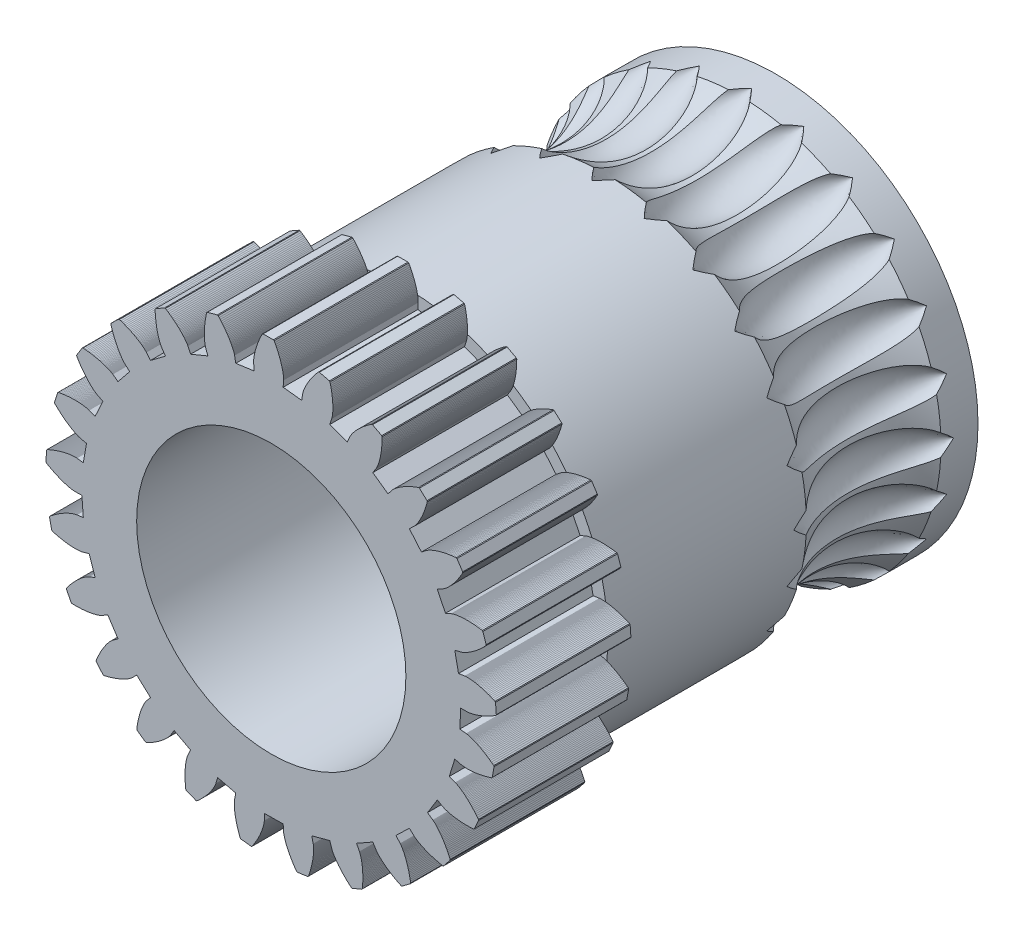
from build123d import *

# Parameters (mm, degrees)
CROQUIS9_R            = 8.142396537
CORTAR_EXTRUIR1_DEPTH = 4
MATRIZC1_COUNT        = 24


with BuildPart() as part:
    # Croquis1 → Revolución1 (revolve)
    with BuildSketch(Plane(origin=(0, 0, 0), x_dir=(1, 0, 0), z_dir=(0, 1, 0))):
        with BuildLine():
            Line((4, 0), (4, 15))
            Line((4, 15), (6, 15))
            Line((6, 15), (6, 13.9))
            ThreePointArc((6, 13.9), (5.275, 11.9), (6, 9.9))
            Line((6, 9.9), (6, 4))
            Line((6, 4), (6.75, 4))
            Line((6.75, 4), (6.75, 0))
            Line((6.75, 0), (4, 0))
        make_face()
    revolve(axis=Axis((0, 0, 0), (0, 0, -1)))

    # Croquis9 → Cortar-Extruir1 (cut)
    with BuildSketch(Plane.XY):
        Circle(CROQUIS9_R)
        Polygon((5.6296, 0), (5.8269832, 1.24e-05), (5.8289672, 6.2e-05), (5.832092, 0.0001798), (5.8363452, 0.000403), (5.8417268, 0.0007626), (5.8482368, 0.0012896), (5.855869, 0.002015), (5.8646172, 0.0029636), (5.8744814, 0.0041788), (5.8854554, 0.0056792), (5.8975268, 0.0075082), (5.9106956, 0.0096906), (5.9249494, 0.0122574), (5.9402758, 0.0152334), (5.9566748, 0.018662), (5.974134, 0.022568), (5.992641, 0.0269762), (6.0121834, 0.0319238), (6.032755, 0.0374356), (6.0543434, 0.0435488), (6.0769238, 0.050282), (6.1005024, 0.0576724), (6.1250482, 0.0657448), (6.1505488, 0.074524), (6.176998, 0.0840472), (6.2043772, 0.0943392), (6.2326678, 0.105431), (6.261845, 0.1173412), (6.2919088, 0.1301008), (6.322822, 0.1437346), (6.3545784, 0.1582798), (6.3871532, 0.1737488), (6.4205278, 0.1901726), (6.4546836, 0.207576), (6.4895958, 0.2259838), (6.5252458, 0.2454208), (6.561615, 0.265918), (6.5986724, 0.2874816), (6.6363932, 0.310155), (6.674765, 0.3339444), (6.686452, 0.3574238), (6.6628982, 0.6649624), (6.6477764, 0.6863896), (6.6062302, 0.7040596), (6.56549, 0.720719), (6.5255806, 0.7363926), (6.4865206, 0.7511114), (6.4483224, 0.764894), (6.411017, 0.7777714), (6.3746106, 0.7897684), (6.3391218, 0.8009222), (6.3045692, 0.8112514), (6.2709714, 0.820787), (6.2383346, 0.8295538), (6.2066836, 0.837589), (6.1760308, 0.8449174), (6.1463824, 0.85157), (6.117757, 0.8575716), (6.090167, 0.8629532), (6.0636248, 0.867752), (6.0381304, 0.8719928), (6.0137086, 0.8757066), (5.9903594, 0.8789244), (5.9681014, 0.881671), (5.9469284, 0.8839898), (5.926859, 0.8858994), (5.9078932, 0.8874432), (5.8900496, 0.8886398), (5.8733158, 0.8895326), (5.8577104, 0.8901464), (5.8432334, 0.8905122), (5.829891, 0.890661), (5.817677, 0.89063), (5.80661, 0.890444), (5.7966714, 0.8901402), (5.7878798, 0.8897496), (5.780229, 0.8893032), (5.7737128, 0.8888258), (5.7683374, 0.8883608), (5.7640966, 0.8879392), (5.7609966, 0.8875796), (5.759025, 0.8873254), (5.563942, 0.8572802), (5.4527388, 1.400022), (5.6439158, 1.4491198), (5.6458254, 1.4496654), (5.64882, 1.4505582), (5.652881, 1.4518354), (5.6580084, 1.4535218), (5.6641836, 1.4556484), (5.6713942, 1.4582462), (5.679634, 1.46134), (5.6888844, 1.4649732), (5.6991392, 1.4691582), (5.7103798, 1.473926), (5.7225876, 1.4793138), (5.7357564, 1.4853464), (5.7498614, 1.4920424), (5.7648964, 1.4994452), (5.7808366, 1.5075672), (5.7976634, 1.5164394), (5.8153644, 1.5260928), (5.8339148, 1.536546), (5.8533022, 1.54783), (5.8735018, 1.5599696), (5.8945012, 1.5729896), (5.9162694, 1.5869148), (5.9387878, 1.6017638), (5.9620378, 1.6175676), (5.9859946, 1.6343448), (6.0106334, 1.652114), (6.0359418, 1.6709124), (6.0618826, 1.6907462), (6.088431, 1.7116402), (6.1155746, 1.7336254), (6.1432824, 1.756708), (6.1715234, 1.780919), (6.200279, 1.8062708), (6.2295182, 1.832782), (6.25921, 1.8604774), (6.2893358, 1.8893694), (6.3198646, 1.9194766), (6.3507716, 1.9508114), (6.3820196, 1.9834048), (6.3875004, 2.009048), (6.2882012, 2.301068), (6.2682248, 2.318056), (6.223591, 2.324845), (6.1799864, 2.3308466), (6.1374358, 2.3361042), (6.0959392, 2.3406426), (6.0555152, 2.3444928), (6.0161762, 2.347692), (5.9779284, 2.3502588), (5.9407842, 2.3522366), (5.9047498, 2.353644), (5.8698314, 2.3545244), (5.8360476, 2.3549026), (5.8033922, 2.3548158), (5.7718776, 2.3542888), (5.74151, 2.3533588), (5.7122894, 2.3520506), (5.6842282, 2.3504076), (5.6573202, 2.3484546), (5.6315778, 2.3462164), (5.607001, 2.3437426), (5.5835836, 2.3410518), (5.561338, 2.3381812), (5.540258, 2.3351556), (5.5203436, 2.3320184), (5.5015886, 2.3287944), (5.4840054, 2.3255208), (5.4675816, 2.3222224), (5.452311, 2.3189302), (5.4381998, 2.3156876), (5.4252356, 2.3125132), (5.4134184, 2.3094442), (5.4027358, 2.3065116), (5.393194, 2.3037464), (5.3847744, 2.3011796), (5.3774708, 2.2988422), (5.371277, 2.2967652), (5.3661868, 2.2949796), (5.3621878, 2.2935164), (5.3592738, 2.2924004), (5.3574262, 2.2916626), (5.175946, 2.2140448), (4.9332532, 2.7120784), (5.1062208, 2.8071802), (5.1079382, 2.8081784), (5.1106104, 2.8097904), (5.1142312, 2.8120348), (5.1187758, 2.8149426), (5.1242256, 2.8185386), (5.1305682, 2.8228476), (5.1377788, 2.8279006), (5.1458388, 2.8337162), (5.1547296, 2.8403192), (5.1644264, 2.8477344), (5.1749106, 2.8559866), (5.1861698, 2.8651068), (5.1981668, 2.8751012), (5.210883, 2.886007), (5.2242998, 2.8978366), (5.2383924, 2.9106148), (5.253136, 2.9243664), (5.2685058, 2.93911), (5.2844832, 2.9548642), (5.3010248, 2.9716414), (5.3181244, 2.9894726), (5.3357448, 3.0083764), (5.3538674, 3.028359), (5.372455, 3.0494452), (5.391489, 3.0716536), (5.4109384, 3.0949966), (5.4307722, 3.1194928), (5.4509656, 3.1451546), (5.4714876, 3.1720006), (5.4923072, 3.2000432), (5.5133996, 3.2292886), (5.53474, 3.2597616), (5.556285, 3.2914684), (5.5780098, 3.3244214), (5.5998834, 3.3586268), (5.621881, 3.3941032), (5.6439592, 3.4308568), (5.6660994, 3.4689), (5.6882644, 3.5082328), (5.6871918, 3.5344402), (5.5183968, 3.7925896), (5.4948182, 3.8040782), (5.4498992, 3.799546), (5.4061706, 3.7945178), (5.363651, 3.7890308), (5.322328, 3.7831098), (5.2822202, 3.7767858), (5.2433214, 3.770096), (5.2056378, 3.7630714), (5.1691694, 3.7557492), (5.13391, 3.7481542), (5.0998782, 3.7403236), (5.0670554, 3.7322884), (5.0354478, 3.7240796), (5.0050554, 3.7157344), (4.975872, 3.7072776), (4.9478976, 3.6987464), (4.921126, 3.6901718), (4.895551, 3.681591), (4.8711726, 3.6730226), (4.8479784, 3.66451), (4.8259684, 3.6560842), (4.8051364, 3.64777), (4.78547, 3.6395984), (4.7669568, 3.6316066), (4.749603, 3.6238194), (4.7333838, 3.616274), (4.718293, 3.6089952), (4.7043244, 3.602014), (4.6914594, 3.5953614), (4.6796918, 3.5890622), (4.6690092, 3.5831536), (4.659393, 3.5776542), (4.650837, 3.5726012), (4.6433164, 3.5680256), (4.636825, 3.563946), (4.6313442, 3.5603934), (4.6268616, 3.5573988), (4.6233524, 3.5549808), (4.6208042, 3.5531766), (4.6191984, 3.5520048), (4.4627228, 3.4316938), (4.1038048, 3.8537278), (4.247682, 3.9888506), (4.2490956, 3.9902456), (4.2512842, 3.9924714), (4.2542354, 3.9955466), (4.257912, 3.999496), (4.2622954, 4.004332), (4.267367, 4.0100856), (4.2730958, 4.0167692), (4.279457, 4.0244076), (4.2864258, 4.0330132), (4.2939712, 4.0426108), (4.3020808, 4.0532128), (4.3107112, 4.0648378), (4.3198438, 4.0775044), (4.3294538, 4.0912312), (4.3395102, 4.1060244), (4.349982, 4.1219088), (4.3608382, 4.1388968), (4.3720602, 4.1569946), (4.383617, 4.176227), (4.3954714, 4.196594), (4.4075924, 4.2181204), (4.4199614, 4.2408062), (4.4325412, 4.26467), (4.445307, 4.289718), (4.4582154, 4.3159626), (4.4712478, 4.34341), (4.484367, 4.3720664), (4.497542, 4.4019442), (4.5107418, 4.4330496), (4.5239416, 4.4653888), (4.537098, 4.4989618), (4.5501862, 4.533781), (4.563169, 4.5698526), (4.5760154, 4.6071704), (4.5887006, 4.6457468), (4.6011812, 4.6855756), (4.6134262, 4.7266692), (4.6254108, 4.7690152), (4.6370916, 4.812626), (4.62954, 4.8377422), (4.401845, 5.045808), (4.3761522, 5.0510718), (4.333769, 5.0355098), (4.2926692, 5.019768), (4.2528466, 5.0038774), (4.2143012, 4.9878628), (4.1770206, 4.9717676), (4.1410048, 4.9556104), (4.1062538, 4.9394408), (4.072749, 4.9232712), (4.0404966, 4.9071512), (4.0094718, 4.8910994), (3.9796808, 4.875153), (3.9511112, 4.859343), (3.9237444, 4.8437004), (3.8975804, 4.8282562), (3.8726068, 4.8130352), (3.8488112, 4.7980746), (3.826175, 4.7833992), (3.804692, 4.76904), (3.7843436, 4.755028), (3.7651236, 4.741388), (3.7470134, 4.7281572), (3.7299944, 4.7153542), (3.7140542, 4.70301), (3.6991742, 4.6911494), (3.685342, 4.6798096), (3.672539, 4.669003), (3.6607404, 4.6587668), (3.64994, 4.6491258), (3.6401068, 4.6400986), (3.6312284, 4.6317162), (3.6232862, 4.6240034), (3.6162492, 4.6169788), (3.6101112, 4.6106734), (3.604835, 4.605112), (3.6004082, 4.600307), (3.5968122, 4.5962894), (3.594016, 4.5930778), (3.5919948, 4.5906908), (3.59073, 4.5891594), (3.4690922, 4.433713), (3.0164922, 4.75323), (3.1222456, 4.919886), (3.1232686, 4.921591), (3.1248372, 4.9242942), (3.1269266, 4.9280018), (3.1295058, 4.9327448), (3.13255, 4.9385232), (3.1360344, 4.9453494), (3.1399156, 4.9532482), (3.1441812, 4.962232), (3.1487878, 4.9723008), (3.1537168, 4.9834732), (3.1589248, 4.9957554), (3.1643994, 5.009166), (3.1700972, 5.023705), (3.1759872, 5.039391), (3.1820446, 5.0562178), (3.1882384, 5.0742102), (3.1945376, 5.093362), (3.200905, 5.1136856), (3.2073096, 5.135181), (3.2137266, 5.1578606), (3.2201188, 5.1817244), (3.2264552, 5.2067724), (3.2327048, 5.233017), (3.2388366, 5.260452), (3.2448196, 5.2890774), (3.2506104, 5.3189056), (3.2561904, 5.3499242), (3.2615224, 5.3821394), (3.2665754, 5.4155512), (3.2713184, 5.4501596), (3.275708, 5.4859522), (3.2797256, 5.522929), (3.283334, 5.5610962), (3.286496, 5.6004352), (3.2891868, 5.6409522), (3.2913692, 5.6826348), (3.2930122, 5.725483), (3.2940848, 5.7694844), (3.294556, 5.8146266), (3.2809966, 5.8370768), (3.0087112, 5.981977), (2.9825162, 5.9806874), (2.9453348, 5.9550752), (2.909443, 5.9296056), (2.8748222, 5.9043096), (2.8414662, 5.879212), (2.8093626, 5.85435), (2.778499, 5.8297484), (2.7488568, 5.8054382), (2.7204298, 5.7814504), (2.6931932, 5.757816), (2.6671408, 5.7345536), (2.642254, 5.7117004), (2.618508, 5.6892812), (2.5958966, 5.667327), (2.574395, 5.6458564), (2.5539908, 5.6249066), (2.5346592, 5.6044962), (2.5163816, 5.58465), (2.4991456, 5.565399), (2.4829264, 5.546768), (2.4676992, 5.5287818), (2.4534454, 5.511459), (2.4401464, 5.4948244), (2.4277774, 5.4789028), (2.4163136, 5.463719), (2.4057426, 5.4492916), (2.3960272, 5.4356392), (2.3871426, 5.4227928), (2.3790826, 5.4107648), (2.3718038, 5.39958), (2.3652876, 5.3892508), (2.3595092, 5.379802), (2.3544438, 5.3712522), (2.3500604, 5.36362), (2.3463404, 5.3569178), (2.3432466, 5.3511642), (2.3407604, 5.3463778), (2.3388508, 5.342571), (2.3374868, 5.3397624), (2.3366436, 5.3379582), (2.257482, 5.1571476), (1.7396394, 5.3540658), (1.8006288, 5.5417894), (1.801193, 5.543699), (1.8020424, 5.546706), (1.803146, 5.5508166), (1.8044666, 5.5560494), (1.8059794, 5.5624044), (1.8076472, 5.5698816), (1.8094452, 5.5784996), (1.8113424, 5.5882584), (1.8133016, 5.599158), (1.815298, 5.6112046), (1.8172882, 5.6243982), (1.8192536, 5.638745), (1.821157, 5.654245), (1.8229612, 5.6709044), (1.8246476, 5.6887108), (1.8261728, 5.7076766), (1.8275058, 5.7277956), (1.8286218, 5.7490616), (1.8294774, 5.7714746), (1.830054, 5.7950408), (1.8303082, 5.8197416), (1.8302214, 5.8455832), (1.829744, 5.8725532), (1.8288636, 5.9006516), (1.8275368, 5.929866), (1.8257326, 5.9601964), (1.82342, 5.9916304), (1.8205742, 6.0241618), (1.817158, 6.0577782), (1.8131404, 6.0924734), (1.8084966, 6.128235), (1.8031894, 6.1650506), (1.797194, 6.202914), (1.7904732, 6.2418066), (1.7830022, 6.2817222), (1.77475, 6.322636), (1.7656856, 6.364548), (1.7557842, 6.4074334), (1.7450148, 6.4512736), (1.726297, 6.4696442), (1.4265332, 6.5422772), (1.401479, 6.5345148), (1.3718368, 6.5004644), (1.3434036, 6.4668666), (1.3161608, 6.4337524), (1.290096, 6.4011528), (1.2651844, 6.3690864), (1.2414074, 6.3375842), (1.2187464, 6.3066648), (1.1971766, 6.2763592), (1.1766732, 6.2466922), (1.1572238, 6.2176824), (1.1387974, 6.1893546), (1.1213754, 6.1617398), (1.104933, 6.1348504), (1.0894454, 6.108705), (1.074894, 6.0833408), (1.0612478, 6.058764), (1.048482, 6.0349994), (1.0365718, 6.0120656), (1.0254924, 5.9899874), (1.015219, 5.9687772), (1.0057206, 5.9484536), (0.9969786, 5.9290352), (0.9889558, 5.9105344), (0.9816336, 5.892976), (0.9749748, 5.8763724), (0.9689608, 5.860736), (0.9635544, 5.8460854), (0.958737, 5.8324268), (0.9544652, 5.819785), (0.9507266, 5.80816), (0.9474778, 5.7975766), (0.9447002, 5.7880348), (0.9423504, 5.779547), (0.940416, 5.7721318), (0.9388474, 5.7657892), (0.9376322, 5.7605316), (0.936727, 5.7563714), (0.936107, 5.7533086), (0.935735, 5.7513556), (0.9040282, 5.5565392), (0.3534868, 5.6184896), (0.3658682, 5.8154822), (0.3659426, 5.8174724), (0.366017, 5.820591), (0.3660604, 5.8248504), (0.3660418, 5.8302444), (0.365924, 5.8367792), (0.3656822, 5.8444424), (0.3652854, 5.853234), (0.3646902, 5.863154), (0.363878, 5.8741962), (0.3628178, 5.8863606), (0.3614662, 5.899641), (0.3597984, 5.914025), (0.3577896, 5.9295126), (0.3553964, 5.9460914), (0.352594, 5.9637614), (0.3493576, 5.9825102), (0.3456438, 6.0023254), (0.341434, 6.0232008), (0.3366972, 6.0451302), (0.33139, 6.068095), (0.3255, 6.0920828), (0.3189838, 6.1170874), (0.3118166, 6.1430964), (0.3039736, 6.1700912), (0.2954238, 6.1980594), (0.28613, 6.2269886), (0.2760798, 6.2568602), (0.2652298, 6.2876618), (0.2535614, 6.3193686), (0.2410436, 6.3519744), (0.2276516, 6.3854606), (0.2133544, 6.4198024), (0.1981272, 6.4549812), (0.1819452, 6.4909846), (0.1647836, 6.5277816), (0.1466176, 6.5653598), (0.1274162, 6.6037006), (0.1071608, 6.642773), (0.0858266, 6.6825646), (0.0631284, 6.6957024), (-0.2452844, 6.691505), (-0.2676168, 6.6777534), (-0.2878598, 6.6373976), (-0.3070488, 6.5977858), (-0.3251962, 6.5589428), (-0.342333, 6.520881), (-0.3584902, 6.4836314), (-0.3736864, 6.4472002), (-0.3879464, 6.4116184), (-0.4013074, 6.3769046), (-0.4137818, 6.343065), (-0.4254068, 6.3101306), (-0.4362072, 6.2781138), (-0.446214, 6.2470332), (-0.455452, 6.216895), (-0.4639522, 6.187724), (-0.4717394, 6.1595326), (-0.4788446, 6.1323332), (-0.485305, 6.1061444), (-0.491133, 6.0809724), (-0.496372, 6.0568296), (-0.5010468, 6.0337284), (-0.5051946, 6.0116812), (-0.508834, 5.9907004), (-0.5120022, 5.9707922), (-0.5147302, 5.9519628), (-0.517049, 5.9342246), (-0.5189896, 5.9175838), (-0.5205768, 5.9020466), (-0.521854, 5.8876192), (-0.5228398, 5.874314), (-0.5235776, 5.8621248), (-0.524086, 5.8510578), (-0.5244084, 5.8411254), (-0.5245696, 5.8323276), (-0.5246006, 5.8246582), (-0.5245386, 5.8181296), (-0.5244146, 5.8127356), (-0.5242534, 5.8084762), (-0.5240922, 5.8053576), (-0.523962, 5.8033736), (-0.5062238, 5.6067964), (-1.0548804, 5.5298854), (-1.0918758, 5.7237656), (-1.0922974, 5.7257124), (-1.0930042, 5.7287504), (-1.094021, 5.732892), (-1.0953788, 5.7381124), (-1.0971148, 5.7444054), (-1.09926, 5.751771), (-1.101833, 5.7601844), (-1.104871, 5.7696456), (-1.108405, 5.7801422), (-1.1124598, 5.7916618), (-1.1170726, 5.8041858), (-1.122262, 5.8177018), (-1.1280652, 5.8322036), (-1.1345008, 5.8476726), (-1.141606, 5.8640902), (-1.1494118, 5.8814378), (-1.1579306, 5.8997092), (-1.1671996, 5.9188858), (-1.1772436, 5.9389428), (-1.1880936, 5.9598678), (-1.1997682, 5.981636), (-1.2122984, 6.004235), (-1.2257028, 6.0276462), (-1.2400124, 6.0518386), (-1.255252, 6.076806), (-1.2714464, 6.1025112), (-1.2886142, 6.128948), (-1.3067802, 6.1560792), (-1.3259692, 6.1838924), (-1.3461998, 6.2123628), (-1.367503, 6.2414656), (-1.3898912, 6.2711698), (-1.413383, 6.3014568), (-1.4380094, 6.3323018), (-1.4637828, 6.36368), (-1.490728, 6.3955604), (-1.5188574, 6.4279182), (-1.5481958, 6.4607286), (-1.5787556, 6.4939606), (-1.6040082, 6.501041), (-1.9016888, 6.4202798), (-1.9198982, 6.401407), (-1.929471, 6.3572878), (-1.9382068, 6.3141482), (-1.9461242, 6.2720068), (-1.9532604, 6.2308822), (-1.9596402, 6.1907806), (-1.9653008, 6.1517206), (-1.970267, 6.1137084), (-1.9745698, 6.0767564), (-1.9782402, 6.0408832), (-1.9813092, 6.006095), (-1.9838078, 5.972398), (-1.9857732, 5.9397984), (-1.987224, 5.9083148), (-1.9882036, 5.8779472), (-1.9887368, 5.8487018), (-1.9888546, 5.820591), (-1.9885942, 5.793621), (-1.9879804, 5.7677856), (-1.9870504, 5.7430972), (-1.9858352, 5.719562), (-1.9843658, 5.69718), (-1.9826732, 5.6759512), (-1.9807946, 5.6558756), (-1.9787548, 5.6369594), (-1.9765848, 5.6192026), (-1.974328, 5.6026052), (-1.972003, 5.587161), (-1.969647, 5.57287), (-1.9672972, 5.5597322), (-1.9649784, 5.5477476), (-1.9627216, 5.5369038), (-1.960564, 5.5272008), (-1.9585304, 5.5186386), (-1.9566518, 5.5112048), (-1.9549716, 5.5048932), (-1.9535084, 5.4997038), (-1.9522932, 5.495618), (-1.9513632, 5.4926358), (-1.9507432, 5.4907448), (-1.884676, 5.304751), (-2.3969696, 5.0938146), (-2.4810168, 5.2724056), (-2.4819096, 5.274185), (-2.483348, 5.2769564), (-2.485363, 5.2807074), (-2.4879794, 5.2854256), (-2.491222, 5.2910924), (-2.495128, 5.2976892), (-2.499716, 5.3052036), (-2.5050108, 5.3136108), (-2.5110434, 5.3228984), (-2.5178386, 5.3330478), (-2.5254212, 5.344028), (-2.5338098, 5.3558328), (-2.5430354, 5.3684374), (-2.5531166, 5.381817), (-2.5640844, 5.3959468), (-2.5759512, 5.4108144), (-2.588748, 5.426395), (-2.6024996, 5.4426576), (-2.6172122, 5.4595898), (-2.632923, 5.4771606), (-2.6496506, 5.4953452), (-2.6674012, 5.5141188), (-2.686212, 5.5334566), (-2.7060892, 5.5533338), (-2.7270576, 5.5737194), (-2.7491358, 5.5945948), (-2.7723362, 5.615929), (-2.7966774, 5.637691), (-2.8221842, 5.6598622), (-2.8488628, 5.6824054), (-2.8767256, 5.7052896), (-2.9057974, 5.7284962), (-2.9360906, 5.7519942), (-2.9676114, 5.7757464), (-3.0003784, 5.799728), (-3.034404, 5.8239018), (-3.0697006, 5.8482492), (-3.1062744, 5.872733), (-3.144144, 5.8973222), (-3.1703638, 5.8978988), (-3.4386006, 5.7456454), (-3.4515462, 5.7228356), (-3.4498474, 5.6777182), (-3.4475782, 5.6337664), (-3.4447696, 5.5909802), (-3.4414526, 5.549372), (-3.4376582, 5.5089418), (-3.4334236, 5.469702), (-3.4287798, 5.4316464), (-3.423764, 5.3947936), (-3.4183948, 5.3591312), (-3.4127156, 5.3246716), (-3.4067574, 5.2914086), (-3.4005512, 5.2593484), (-3.394128, 5.228491), (-3.387525, 5.1988364), (-3.380767, 5.1703784), (-3.3738912, 5.1431232), (-3.3669286, 5.1170584), (-3.3599164, 5.0921902), (-3.3528732, 5.0685124), (-3.3458424, 5.0460126), (-3.338855, 5.024697), (-3.3319358, 5.0045594), (-3.325122, 4.9855812), (-3.3184446, 4.9677686), (-3.3119284, 4.9511092), (-3.3056106, 4.9355906), (-3.299516, 4.9212128), (-3.293688, 4.9079572), (-3.288139, 4.8958176), (-3.2829124, 4.8847816), (-3.278033, 4.874843), (-3.2735256, 4.8659832), (-3.2694274, 4.858196), (-3.2657632, 4.8514566), (-3.262564, 4.845765), (-3.2598546, 4.8411026), (-3.257666, 4.8374508), (-3.256023, 4.834791), (-3.2549504, 4.833117), (-3.144702, 4.6693936), (-3.5884422, 4.3376812), (-3.714265, 4.489761), (-3.7155732, 4.4912614), (-3.7176564, 4.4935864), (-3.7205394, 4.4967236), (-3.724247, 4.500642), (-3.7287978, 4.505323), (-3.7342228, 4.5107418), (-3.7405344, 4.5168798), (-3.7477574, 4.523706), (-3.7559104, 4.5312018), (-3.765012, 4.5393362), (-3.775087, 4.5480906), (-3.7861478, 4.5574402), (-3.798213, 4.5673478), (-3.8113074, 4.577801), (-3.8254434, 4.5887626), (-3.8406396, 4.600214), (-3.8569084, 4.612118), (-3.8742684, 4.624456), (-3.8927382, 4.6371908), (-3.912324, 4.6503038), (-3.9330382, 4.6637578), (-3.9549056, 4.6775218), (-3.9779324, 4.6915772), (-4.002131, 4.7058868), (-4.0275076, 4.7204196), (-4.054087, 4.7351508), (-4.081863, 4.7500432), (-4.1108542, 4.7650658), (-4.1410668, 4.7802), (-4.1725132, 4.7953962), (-4.2051996, 4.8106358), (-4.239126, 4.8258816), (-4.274311, 4.8411088), (-4.3107484, 4.856274), (-4.3484506, 4.8713524), (-4.3874238, 4.8863068), (-4.4276618, 4.9011124), (-4.469177, 4.915732), (-4.5119694, 4.9301284), (-4.5375072, 4.9241702), (-4.7594548, 4.7099912), (-4.7663244, 4.6846766), (-4.7534532, 4.6414006), (-4.7403278, 4.5993956), (-4.7269606, 4.5586492), (-4.7134012, 4.5191738), (-4.6996744, 4.480957), (-4.6858174, 4.444005), (-4.671855, 4.4082992), (-4.6578306, 4.373852), (-4.6437628, 4.3406448), (-4.6296888, 4.3086776), (-4.6156458, 4.2779442), (-4.6016648, 4.2484322), (-4.5877706, 4.2201416), (-4.5739942, 4.19306), (-4.5603728, 4.1671812), (-4.5469374, 4.1424866), (-4.5337128, 4.1189762), (-4.52073, 4.0966314), (-4.5080262, 4.075446), (-4.49562, 4.0554076), (-4.4835486, 4.0364976), (-4.471843, 4.0187098), (-4.4605218, 4.0020256), (-4.4496222, 3.9864326), (-4.439169, 3.9719184), (-4.429187, 3.9584582), (-4.4197134, 3.9460458), (-4.4107668, 3.9346564), (-4.4023782, 3.9242776), (-4.3945662, 3.9148908), (-4.387368, 3.9064774), (-4.3808022, 3.8990188), (-4.3748936, 3.8924902), (-4.3696732, 3.8868792), (-4.3651534, 3.882161), (-4.3613714, 3.878317), (-4.3583396, 3.8753224), (-4.356089, 3.8731586), (-4.3546382, 3.8718008), (-4.207134, 3.7406398), (-4.5544394, 3.3089958), (-4.7141328, 3.425004), (-4.7157696, 3.4261324), (-4.7183674, 3.4278684), (-4.7219386, 3.4301872), (-4.726508, 3.433064), (-4.7320818, 3.4364616), (-4.7386786, 3.4403676), (-4.746317, 3.4447386), (-4.7550094, 3.449556), (-4.7647744, 3.4547888), (-4.775612, 3.460406), (-4.787547, 3.4663828), (-4.8005856, 3.472682), (-4.8147402, 3.4792788), (-4.8300232, 3.4861484), (-4.8464408, 3.4932536), (-4.8640054, 3.5005634), (-4.8827232, 3.5080468), (-4.9026066, 3.515679), (-4.9236618, 3.5234228), (-4.9458888, 3.5312472), (-4.9693062, 3.5391274), (-4.9939078, 3.5470262), (-5.019706, 3.5549126), (-5.0467008, 3.5627556), (-5.0748984, 3.570518), (-5.1042988, 3.578175), (-5.1349082, 3.5856894), (-5.1667266, 3.5930364), (-5.199754, 3.6001788), (-5.2339966, 3.6070794), (-5.269442, 3.6137134), (-5.3060964, 3.6200436), (-5.3439598, 3.626039), (-5.383026, 3.6316624), (-5.423295, 3.6368952), (-5.4647606, 3.6416878), (-5.5074166, 3.6460216), (-5.551263, 3.6498532), (-5.5962874, 3.653164), (-5.6195436, 3.6410368), (-5.781252, 3.3783862), (-5.7816116, 3.3521664), (-5.7583864, 3.3134474), (-5.7352232, 3.2760242), (-5.7121468, 3.2398844), (-5.6891944, 3.2050218), (-5.666397, 3.1714178), (-5.6437794, 3.1390724), (-5.621385, 3.1079608), (-5.5992262, 3.078083), (-5.5773464, 3.0494204), (-5.5557642, 3.0219544), (-5.534523, 2.9956788), (-5.5136352, 2.970575), (-5.4931442, 2.9466244), (-5.4730686, 2.9238208), (-5.4534394, 2.9021394), (-5.4342814, 2.8815678), (-5.4156256, 2.8620812), (-5.3974968, 2.8436672), (-5.3799198, 2.8263072), (-5.3629194, 2.8099826), (-5.3465266, 2.7946748), (-5.33076, 2.7803528), (-5.3156506, 2.7670104), (-5.301217, 2.7546166), (-5.2874778, 2.743159), (-5.2744702, 2.7326004), (-5.2622004, 2.7229346), (-5.2507056, 2.7141306), (-5.2399982, 2.7061636), (-5.2300968, 2.699015), (-5.2210324, 2.6926538), (-5.2128174, 2.6870614), (-5.2054766, 2.6822068), (-5.1990162, 2.6780714), (-5.1934734, 2.6746242), (-5.1888482, 2.6718404), (-5.1851716, 2.6696952), (-5.1824498, 2.6681576), (-5.1807076, 2.667209), (-5.0052228, 2.5768502), (-5.2342694, 2.0723934), (-5.4177956, 2.145045), (-5.4196618, 2.1457332), (-5.4226068, 2.1467686), (-5.426643, 2.1481264), (-5.4317828, 2.1497694), (-5.4380262, 2.151679), (-5.4453918, 2.153818), (-5.4538796, 2.1561554), (-5.4634958, 2.1586602), (-5.4742466, 2.1613014), (-5.4861444, 2.1640418), (-5.4991892, 2.1668628), (-5.5133872, 2.169721), (-5.5287384, 2.1725978), (-5.545249, 2.1754436), (-5.562919, 2.178246), (-5.5817484, 2.1809554), (-5.6017434, 2.1835532), (-5.6228978, 2.185996), (-5.6452116, 2.1882652), (-5.668691, 2.1903174), (-5.6933298, 2.1921216), (-5.719128, 2.193653), (-5.7460732, 2.1948744), (-5.7741716, 2.195761), (-5.8034108, 2.1962694), (-5.833797, 2.1963748), (-5.8653116, 2.19604), (-5.8979608, 2.1952402), (-5.931726, 2.1939444), (-5.966601, 2.1921154), (-6.0025858, 2.1897222), (-6.0396618, 2.18674), (-6.077829, 2.1831316), (-6.1170688, 2.178866), (-6.1573688, 2.1739184), (-6.1987228, 2.1682516), (-6.2411184, 2.1618346), (-6.2845432, 2.1546488), (-6.3289724, 2.1466508), (-6.3484838, 2.1291234), (-6.4397974, 1.8345118), (-6.4336222, 1.8090236), (-6.4015, 1.7772982), (-6.369756, 1.7468066), (-6.338415, 1.7175426), (-6.3075142, 1.6894814), (-6.2770784, 1.6626044), (-6.2471262, 1.6368992), (-6.2176948, 1.612341), (-6.1888028, 1.588905), (-6.1604812, 1.566585), (-6.1327486, 1.54535), (-6.105636, 1.5251814), (-6.0791682, 1.5060606), (-6.0533638, 1.4879628), (-6.0282476, 1.4708694), (-6.0038382, 1.4547494), (-5.9801728, 1.4395842), (-5.9572576, 1.4253552), (-5.9351174, 1.4120252), (-5.913777, 1.3995818), (-5.8932488, 1.3880002), (-5.8735638, 1.3772432), (-5.8547344, 1.3672984), (-5.836773, 1.3581286), (-5.8197106, 1.3497214), (-5.8035596, 1.3420334), (-5.7883324, 1.335046), (-5.7740476, 1.3287344), (-5.7607238, 1.3230614), (-5.7483672, 1.3180084), (-5.7370026, 1.3135444), (-5.7266424, 1.3096384), (-5.7172928, 1.3062656), (-5.7089724, 1.303395), (-5.7016936, 1.3009956), (-5.6954626, 1.2990364), (-5.6902918, 1.2974864), (-5.6861936, 1.2963208), (-5.6831804, 1.2955148), (-5.6812522, 1.2950188), (-5.4888104, 1.2511476), (-5.585208, 0.7055786), (-5.781035, 0.7303042), (-5.7830128, 0.7305026), (-5.7861252, 0.7307754), (-5.7903722, 0.7310854), (-5.79576, 0.7314016), (-5.8022824, 0.7316992), (-5.8099456, 0.731941), (-5.8187496, 0.7320898), (-5.8286882, 0.732127), (-5.8397614, 0.7320092), (-5.851963, 0.7317054), (-5.8652992, 0.7311908), (-5.8797638, 0.7304344), (-5.8953444, 0.729399), (-5.9120472, 0.7280536), (-5.9298536, 0.7263672), (-5.9487698, 0.724315), (-5.9687772, 0.7218536), (-5.9898758, 0.7189644), (-6.0120594, 0.715604), (-6.0353094, 0.7117538), (-6.0596258, 0.7073828), (-6.08499, 0.7024476), (-6.1113958, 0.6969296), (-6.1388246, 0.6907978), (-6.1672764, 0.684015), (-6.1967326, 0.6765626), (-6.2271746, 0.6684034), (-6.2585962, 0.6595126), (-6.2909788, 0.6498592), (-6.32431, 0.6394122), (-6.358565, 0.6281468), (-6.3937376, 0.616032), (-6.429803, 0.6030492), (-6.4667488, 0.5891612), (-6.5045564, 0.5743432), (-6.543201, 0.5585704), (-6.5826702, 0.541818), (-6.6229392, 0.524055), (-6.6639894, 0.5052566), (-6.6785284, 0.4834264), (-6.693706, 0.1753608), (-6.6813804, 0.15221), (-6.6423762, 0.1294746), (-6.6040478, 0.1078366), (-6.56642, 0.0872836), (-6.5295114, 0.0677908), (-6.4933468, 0.0493272), (-6.4579448, 0.0318742), (-6.423324, 0.015407), (-6.3895154, -0.0001054), (-6.3565314, -0.0146816), (-6.3243906, -0.0283526), (-6.2931178, -0.0411432), (-6.2627192, -0.0530782), (-6.2332258, -0.0641948), (-6.20465, -0.0745054), (-6.176998, -0.0840472), (-6.1503008, -0.0928512), (-6.1245646, -0.100936), (-6.099808, -0.1083388), (-6.0760434, -0.1150844), (-6.0532832, -0.1211976), (-6.0315398, -0.1267218), (-6.0108256, -0.1316694), (-5.9911592, -0.1360838), (-5.9725344, -0.1399898), (-5.954976, -0.1434184), (-5.9384902, -0.1463944), (-5.9230894, -0.1489612), (-5.9087674, -0.1511374), (-5.895549, -0.1529602), (-5.8834342, -0.1544544), (-5.872423, -0.1556634), (-5.8625278, -0.1566058), (-5.8537548, -0.1573188), (-5.846104, -0.1578334), (-5.8395816, -0.1581806), (-5.8341938, -0.1583914), (-5.8299344, -0.158503), (-5.8268096, -0.1585402), (-5.8248256, -0.158534), (-5.6275168, -0.153171), (-5.585208, -0.7055786), (-5.781035, -0.7303228), (-5.7830004, -0.7306204), (-5.7860818, -0.731135), (-5.790273, -0.7318914), (-5.7955678, -0.7329206), (-5.80196, -0.7342598), (-5.8094434, -0.7359338), (-5.8180056, -0.7379736), (-5.8276404, -0.7404102), (-5.8383354, -0.7432808), (-5.8500844, -0.746604), (-5.862875, -0.750417), (-5.8766886, -0.7547508), (-5.8915252, -0.7596302), (-5.9073662, -0.7650862), (-5.9241992, -0.7711498), (-5.9420056, -0.7778396), (-5.9607792, -0.785199), (-5.9804952, -0.7932466), (-6.0011412, -0.8020134), (-6.0227048, -0.8115242), (-6.0451674, -0.82181), (-6.0685104, -0.8328956), (-6.0927152, -0.8448058), (-6.117757, -0.8575716), (-6.1436296, -0.8712116), (-6.1703082, -0.8857568), (-6.1977618, -0.901232), (-6.2259842, -0.9176558), (-6.2549506, -0.9350654), (-6.28463, -0.953467), (-6.31501, -0.9728978), (-6.3460658, -0.9933764), (-6.3777726, -1.0149276), (-6.4100994, -1.0375638), (-6.4430338, -1.061316), (-6.4765448, -1.086209), (-6.5106076, -1.112249), (-6.5451912, -1.139467), (-6.580277, -1.1678816), (-6.5889322, -1.1926382), (-6.527019, -1.4948014), (-6.5093304, -1.514164), (-6.4658932, -1.5264896), (-6.423386, -1.53791), (-6.3818274, -1.5484624), (-6.3412298, -1.5581654), (-6.3016118, -1.56705), (-6.2629796, -1.5751534), (-6.225358, -1.5824942), (-6.1887532, -1.5891096), (-6.1531776, -1.5950244), (-6.1186498, -1.6002758), (-6.085176, -1.6048824), (-6.0527686, -1.6088876), (-6.0214338, -1.6123162), (-5.9911902, -1.6151992), (-5.9620378, -1.6175676), (-5.933989, -1.6194524), (-5.90705, -1.6208846), (-5.8812332, -1.6218952), (-5.8565324, -1.6225152), (-5.8329662, -1.6227818), (-5.8105346, -1.6227198), (-5.7892438, -1.6223664), (-5.7690876, -1.6217464), (-5.7500846, -1.6209032), (-5.7322286, -1.6198554), (-5.7155196, -1.6186402), (-5.6999576, -1.6172886), (-5.6855488, -1.6158378), (-5.6722932, -1.6143188), (-5.6601784, -1.6127564), (-5.6492168, -1.6111816), (-5.6394022, -1.6096378), (-5.6307284, -1.6081436), (-5.6231892, -1.6067424), (-5.6167846, -1.605459), (-5.6115084, -1.6043244), (-5.6073606, -1.6033696), (-5.6043226, -1.6026256), (-5.6024006, -1.6021296), (-5.4126248, -1.5478672), (-5.2342694, -2.0723934), (-5.4177894, -2.1450636), (-5.4196184, -2.1458448), (-5.4224704, -2.1471034), (-5.4263454, -2.1488766), (-5.4312186, -2.1511954), (-5.4370776, -2.1540784), (-5.44391, -2.1575628), (-5.4516972, -2.1616672), (-5.4604206, -2.1664226), (-5.4700678, -2.17186), (-5.4806202, -2.1780042), (-5.4920592, -2.18488), (-5.5043662, -2.1925122), (-5.5175226, -2.2009256), (-5.5315098, -2.2101512), (-5.546303, -2.2202076), (-5.5618836, -2.2311196), (-5.5782392, -2.2429182), (-5.5953326, -2.2556158), (-5.6131514, -2.2692434), (-5.6316708, -2.2838134), (-5.6508722, -2.299363), (-5.6707246, -2.3159046), (-5.6912032, -2.333463), (-5.7122894, -2.3520506), (-5.7339522, -2.3716984), (-5.756173, -2.392425), (-5.7789208, -2.4142366), (-5.8021708, -2.4371704), (-5.8258982, -2.4612264), (-5.850072, -2.4864356), (-5.8746674, -2.5128104), (-5.8996534, -2.5403694), (-5.924999, -2.569125), (-5.9506856, -2.5990958), (-5.976676, -2.6302942), (-6.0029454, -2.6627326), (-6.0294566, -2.6964296), (-6.056191, -2.7313914), (-6.0831052, -2.7676428), (-6.085331, -2.7937758), (-5.9502206, -3.071046), (-5.9282664, -3.085399), (-5.8831366, -3.0865336), (-5.8391228, -3.0870296), (-5.7962436, -3.0869118), (-5.7545114, -3.0862112), (-5.7139262, -3.084965), (-5.6744942, -3.0832042), (-5.6362278, -3.0809598), (-5.599127, -3.0782628), (-5.563198, -3.0751504), (-5.528447, -3.0716474), (-5.4948802, -3.0677848), (-5.4624914, -3.063606), (-5.431293, -3.0591296), (-5.4012788, -3.0544052), (-5.372455, -3.0494452), (-5.3448216, -3.044293), (-5.3183724, -3.0389858), (-5.2931136, -3.0335422), (-5.269039, -3.0280056), (-5.2461424, -3.0224008), (-5.22443, -3.016765), (-5.2038956, -3.011123), (-5.184533, -3.005512), (-5.166336, -2.999963), (-5.1492984, -2.994507), (-5.133414, -2.9891812), (-5.1186766, -2.9840042), (-5.1050862, -2.9790132), (-5.092618, -2.9742392), (-5.0812782, -2.9697132), (-5.0710544, -2.9654662), (-5.061928, -2.9615292), (-5.053899, -2.957927), (-5.0469426, -2.9546906), (-5.041065, -2.9518572), (-5.0362352, -2.9494454), (-5.0324532, -2.9474862), (-5.0297004, -2.9460168), (-5.0279582, -2.9450558), (-4.857638, -2.845304), (-4.5544394, -3.3089958), (-4.7141204, -3.4250226), (-4.7157014, -3.4262316), (-4.7181504, -3.428166), (-4.7214612, -3.4308444), (-4.725609, -3.4342978), (-4.7305628, -3.438551), (-4.7363164, -3.4436226), (-4.7428326, -3.4495374), (-4.7501052, -3.456314), (-4.758097, -3.4639772), (-4.7667894, -3.4725518), (-4.7761576, -3.4820564), (-4.7861768, -3.4925096), (-4.7968284, -3.5039362), (-4.8080814, -3.5163486), (-4.819911, -3.5297654), (-4.8322924, -3.5442114), (-4.8451946, -3.559699), (-4.858599, -3.576253), (-4.8724684, -3.5938796), (-4.8867842, -3.6126036), (-4.9015092, -3.6324374), (-4.9166248, -3.6533996), (-4.9320938, -3.6754964), (-4.9478976, -3.6987464), (-4.9639928, -3.7231682), (-4.9803608, -3.7487618), (-4.9969706, -3.775552), (-5.0137912, -3.8035388), (-5.0307854, -3.832747), (-5.0479284, -3.8631766), (-5.0651892, -3.89484), (-5.0825368, -3.9277434), (-5.0999402, -3.9618992), (-5.1173622, -3.9973136), (-5.134778, -4.033999), (-5.1521566, -4.0719492), (-5.1694546, -4.1111828), (-5.1866534, -4.1516936), (-5.2037096, -4.1935002), (-5.1993634, -4.2193604), (-4.9995436, -4.4543218), (-4.9747126, -4.4627662), (-4.9307174, -4.4526416), (-4.8879622, -4.442176), (-4.8464656, -4.4313942), (-4.8062152, -4.4203396), (-4.767211, -4.4090432), (-4.7294592, -4.3975298), (-4.6929474, -4.3858366), (-4.657688, -4.3740008), (-4.6236624, -4.3620472), (-4.5908768, -4.350013), (-4.5593188, -4.3379292), (-4.5289884, -4.3258206), (-4.4998856, -4.3137306), (-4.4719918, -4.301684), (-4.445307, -4.289718), (-4.4198188, -4.2778574), (-4.395521, -4.2661332), (-4.3724074, -4.2545826), (-4.3504656, -4.2432304), (-4.3296894, -4.2321076), (-4.3100602, -4.2212514), (-4.2915718, -4.2106804), (-4.2742118, -4.2004318), (-4.2579616, -4.1905304), (-4.242815, -4.1810072), (-4.2287596, -4.1718932), (-4.2157768, -4.1632194), (-4.203848, -4.1550044), (-4.1929608, -4.1472854), (-4.1831028, -4.140081), (-4.1742554, -4.1334222), (-4.1663938, -4.12734), (-4.1595118, -4.121853), (-4.1535846, -4.1169922), (-4.1485936, -4.1127824), (-4.144514, -4.1092422), (-4.1413396, -4.1064088), (-4.1390394, -4.1042946), (-4.1375886, -4.1029306), (-3.9974252, -3.9639576), (-3.5884422, -4.3376812), (-3.7142526, -4.4897734), (-3.7154802, -4.4913358), (-3.7173712, -4.4938158), (-3.7199132, -4.4972382), (-3.723069, -4.5016154), (-3.7268138, -4.506966), (-3.7311228, -4.5133086), (-3.735965, -4.5206556), (-3.7413156, -4.5290318), (-3.747156, -4.5384434), (-3.7534428, -4.548909), (-3.7601512, -4.5604472), (-3.7672626, -4.5730642), (-3.7747336, -4.5867724), (-3.7825456, -4.6015966), (-3.7906676, -4.6175368), (-3.7990686, -4.6346054), (-3.8077114, -4.652821), (-3.8165774, -4.6721836), (-3.8256294, -4.6927056), (-3.8348364, -4.7144056), (-3.8441674, -4.7372774), (-3.8535976, -4.7613334), (-3.8630836, -4.786586), (-3.8726068, -4.8130352), (-3.88213, -4.8406934), (-3.891616, -4.8695544), (-3.90104, -4.8996306), (-3.910371, -4.930922), (-3.9195656, -4.963441), (-3.9286052, -4.9971752), (-3.9374526, -5.032137), (-3.9460706, -5.0683202), (-3.9544344, -5.105731), (-3.9625006, -5.1443694), (-3.9702506, -5.1842292), (-3.977641, -5.2253104), (-3.9846408, -5.267613), (-3.991219, -5.3111308), (-3.9973446, -5.3558638), (-3.9867054, -5.379833), (-3.7347312, -5.5577172), (-3.7085796, -5.5597198), (-3.668478, -5.5389684), (-3.6296784, -5.5181984), (-3.5921622, -5.4974408), (-3.5559232, -5.4767266), (-3.5209552, -5.4560806), (-3.487252, -5.43554), (-3.4548012, -5.4151358), (-3.4235842, -5.3949052), (-3.3936072, -5.3748668), (-3.3648392, -5.3550516), (-3.3372802, -5.3354968), (-3.3109178, -5.3162334), (-3.2857272, -5.2972862), (-3.2617084, -5.27868), (-3.2388366, -5.260452), (-3.2170994, -5.2426208), (-3.1964844, -5.2252298), (-3.1769668, -5.2082914), (-3.1585404, -5.1918366), (-3.1411804, -5.1758964), (-3.1248682, -5.1604956), (-3.1095914, -5.1456652), (-3.0953252, -5.1314176), (-3.082051, -5.11779), (-3.069744, -5.104801), (-3.058398, -5.0924754), (-3.0479758, -5.0808442), (-3.0384712, -5.0699198), (-3.029847, -5.0597332), (-3.0220908, -5.0503092), (-3.0151716, -5.0416602), (-3.009077, -5.033811), (-3.0037698, -5.0267864), (-2.9992376, -5.020605), (-2.9954494, -5.0152792), (-2.9923804, -5.0108462), (-2.9900058, -5.007306), (-2.988307, -5.0046896), (-2.9872406, -5.0030094), (-2.8860442, -4.8335448), (-2.3969696, -5.0938146), (-2.4809982, -5.272418), (-2.481798, -5.2742346), (-2.4830194, -5.2771114), (-2.4846252, -5.2810546), (-2.4865968, -5.2860766), (-2.4888908, -5.2921898), (-2.4914886, -5.2994066), (-2.494353, -5.307727), (-2.497453, -5.3171696), (-2.5007638, -5.3277406), (-2.5042544, -5.33944), (-2.5078814, -5.3522802), (-2.5116324, -5.3662674), (-2.5154578, -5.381414), (-2.519339, -5.3977076), (-2.523245, -5.4151668), (-2.5271324, -5.4337916), (-2.5309764, -5.453582), (-2.534746, -5.4745442), (-2.5384102, -5.496672), (-2.5419318, -5.5199778), (-2.545286, -5.5444492), (-2.5484356, -5.5700986), (-2.5513434, -5.5969198), (-2.5539908, -5.6249066), (-2.5563344, -5.654059), (-2.5583432, -5.6843708), (-2.5599924, -5.7158482), (-2.5612448, -5.7484788), (-2.5620694, -5.7822626), (-2.5624352, -5.8171872), (-2.562305, -5.8532464), (-2.561654, -5.8904402), (-2.5604512, -5.9287562), (-2.5586594, -5.968182), (-2.5562476, -6.0087176), (-2.553191, -6.0503444), (-2.5494524, -6.0930624), (-2.545007, -6.1368468), (-2.5398114, -6.1816976), (-2.5235488, -6.2022692), (-2.2352488, -6.3118976), (-2.2094196, -6.3073344), (-2.1757412, -6.2772706), (-2.1433214, -6.2474982), (-2.1121478, -6.2180606), (-2.0822018, -6.1889826), (-2.0534648, -6.1602952), (-2.0259306, -6.132017), (-1.9995682, -6.1041852), (-1.9743714, -6.0768246), (-1.9503154, -6.04996), (-1.9273816, -6.0236162), (-1.9055514, -5.9978242), (-1.8848062, -5.9726026), (-1.8651212, -5.9479886), (-1.846484, -5.9239946), (-1.8288636, -5.9006516), (-1.8122414, -5.8779782), (-1.7965988, -5.8559992), (-1.781911, -5.8347394), (-1.7681532, -5.8142236), (-1.7553006, -5.7944704), (-1.7433346, -5.7754922), (-1.7322242, -5.7573262), (-1.7219446, -5.7399786), (-1.7124772, -5.7234804), (-1.703791, -5.7078378), (-1.6958612, -5.6930818), (-1.688663, -5.6792186), (-1.6821716, -5.6662792), (-1.676356, -5.6542698), (-1.6711852, -5.6432028), (-1.6666344, -5.6331092), (-1.6626788, -5.623989), (-1.6592936, -5.615867), (-1.6564354, -5.6087494), (-1.6540918, -5.6026548), (-1.6522256, -5.5975956), (-1.6508058, -5.593578), (-1.6498076, -5.5906206), (-1.6491938, -5.5887296), (-1.5933194, -5.3994188), (-1.0548804, -5.5298854), (-1.0918572, -5.7237718), (-1.0921796, -5.725731), (-1.0926446, -5.7288186), (-1.0932212, -5.7330408), (-1.0938784, -5.7383976), (-1.0945852, -5.744889), (-1.0953044, -5.7525212), (-1.0960112, -5.7612942), (-1.0966684, -5.7712142), (-1.097245, -5.782275), (-1.09771, -5.7944766), (-1.0980386, -5.8078128), (-1.0981874, -5.822296), (-1.0981316, -5.8379138), (-1.097834, -5.8546662), (-1.097276, -5.872547), (-1.096408, -5.89155), (-1.0952114, -5.9116752), (-1.093649, -5.9329164), (-1.091696, -5.9552612), (-1.089309, -5.9787096), (-1.0864694, -6.0032492), (-1.08314, -6.0288738), (-1.0792898, -6.055571), (-1.074894, -6.0833408), (-1.0699154, -6.1121584), (-1.064323, -6.1420238), (-1.058092, -6.1729184), (-1.0511914, -6.204836), (-1.0435902, -6.2377642), (-1.0352574, -6.2716782), (-1.026162, -6.306578), (-1.0162854, -6.3424388), (-1.0055904, -6.3792482), (-0.994046, -6.4169938), (-0.9816336, -6.455657), (-0.968316, -6.4952192), (-0.9540746, -6.5356618), (-0.9388784, -6.5769662), (-0.9226964, -6.6191138), (-0.901821, -6.634992), (-0.5953178, -6.6694826), (-0.5714416, -6.6586388), (-0.5462944, -6.6211412), (-0.5222942, -6.584245), (-0.4994224, -6.5479812), (-0.477648, -6.5123684), (-0.4569524, -6.4774314), (-0.4373108, -6.443195), (-0.4186984, -6.409684), (-0.4010966, -6.376917), (-0.3844806, -6.3449126), (-0.3688132, -6.3136956), (-0.3540882, -6.2832846), (-0.3402622, -6.2536982), (-0.3273228, -6.224955), (-0.3152328, -6.1970798), (-0.3039736, -6.1700912), (-0.2935142, -6.1439954), (-0.2838298, -6.1188172), (-0.2748894, -6.0945752), (-0.266662, -6.0712818), (-0.259129, -6.0489494), (-0.2522532, -6.0275966), (-0.2460098, -6.0072358), (-0.240374, -5.9878794), (-0.2353086, -5.9695398), (-0.2307826, -5.9522356), (-0.2267712, -5.9359668), (-0.2232496, -5.920752), (-0.2201744, -5.9065974), (-0.217527, -5.8935216), (-0.2152702, -5.8815184), (-0.2133792, -5.8706064), (-0.2118168, -5.8607918), (-0.210552, -5.8520808), (-0.20956, -5.8444796), (-0.2088036, -5.8379944), (-0.2082518, -5.8326252), (-0.2078736, -5.8283844), (-0.2076442, -5.825272), (-0.2075202, -5.823288), (-0.2004832, -5.6260288), (0.3534868, -5.6184896), (0.3658868, -5.8154822), (0.3660666, -5.81746), (0.3663828, -5.8205724), (0.3668726, -5.8248008), (0.367567, -5.8301514), (0.3685032, -5.836618), (0.3696998, -5.8441882), (0.3712002, -5.852862), (0.3730292, -5.862627), (0.3752178, -5.8734832), (0.3778032, -5.8854182), (0.380804, -5.8984196), (0.3842636, -5.9124874), (0.3882006, -5.9275968), (0.3926522, -5.9437478), (0.3976432, -5.960928), (0.4032046, -5.979125), (0.4093674, -5.9983202), (0.4161626, -6.0185012), (0.423615, -6.0396618), (0.4317556, -6.0617772), (0.4406092, -6.0848412), (0.4502068, -6.108829), (0.4605732, -6.1337344), (0.4717394, -6.1595326), (0.4837302, -6.1862112), (0.4965704, -6.2137454), (0.510291, -6.2421228), (0.5249168, -6.2713186), (0.5404664, -6.3013204), (0.5569708, -6.3321034), (0.5744548, -6.3636428), (0.5929432, -6.39592), (0.6124608, -6.4289164), (0.6330262, -6.462601), (0.6546642, -6.4969614), (0.6773996, -6.5319666), (0.701251, -6.567598), (0.7262432, -6.6038246), (0.752401, -6.6406278), (0.7765624, -6.6508144), (1.0820178, -6.6079972), (1.102453, -6.591561), (1.1174818, -6.5489856), (1.1315496, -6.5072782), (1.1446874, -6.4664636), (1.15692, -6.4265542), (1.1682784, -6.3875748), (1.1787874, -6.3495254), (1.188478, -6.312437), (1.197375, -6.276322), (1.2055156, -6.2411866), (1.2129246, -6.2070556), (1.2196268, -6.1739414), (1.2256594, -6.141844), (1.2310472, -6.1107882), (1.2358212, -6.0807864), (1.2400124, -6.0518386), (1.243658, -6.0239634), (1.2467766, -5.9971732), (1.2494116, -5.971468), (1.2515816, -5.946854), (1.2533238, -5.923356), (1.2546754, -5.9009616), (1.255655, -5.8796894), (1.256306, -5.8595394), (1.2566532, -5.8405178), (1.2567276, -5.8226246), (1.2565664, -5.8058722), (1.2561944, -5.7902606), (1.255655, -5.7757898), (1.2549668, -5.7624598), (1.254167, -5.7502768), (1.2532866, -5.7392408), (1.2523566, -5.7293456), (1.2514142, -5.7205912), (1.2504904, -5.7129776), (1.24961, -5.706511), (1.248804, -5.7011728), (1.2481158, -5.6969692), (1.247564, -5.693894), (1.247192, -5.6919472), (1.2049514, -5.4991334), (1.7396394, -5.3540658), (1.8006474, -5.5417832), (1.8013046, -5.5436618), (1.8023896, -5.5465882), (1.8039148, -5.5505686), (1.8059174, -5.5555782), (1.8084284, -5.5616046), (1.8114788, -5.5686416), (1.8150872, -5.5766706), (1.8192908, -5.585673), (1.8241082, -5.5956426), (1.8295766, -5.6065608), (1.8357208, -5.618409), (1.8425656, -5.6311748), (1.8501358, -5.6448334), (1.8584624, -5.6593662), (1.8675702, -5.674767), (1.877484, -5.6910048), (1.8882286, -5.708061), (1.8998288, -5.7259232), (1.9123094, -5.7445604), (1.9256952, -5.7639602), (1.9400048, -5.7840978), (1.9552692, -5.8049484), (1.9715008, -5.8264934), (1.9887368, -5.8487018), (2.0069834, -5.8715612), (2.0262654, -5.8950406), (2.0466138, -5.919109), (2.0680348, -5.943754), (2.0905594, -5.9689446), (2.1142, -5.9946498), (2.1389814, -6.020851), (2.164916, -6.0475234), (2.1920224, -6.0746236), (2.2203192, -6.1021392), (2.249825, -6.1300392), (2.2805522, -6.1582926), (2.3125132, -6.1868684), (2.3457328, -6.2157418), (2.3802172, -6.244888), (2.406158, -6.2487444), (2.6913642, -6.1313102), (2.7070688, -6.1103046), (2.7110368, -6.0653298), (2.7142918, -6.02144), (2.716871, -5.9786352), (2.718793, -5.9369402), (2.7201012, -5.896355), (2.7208142, -5.856892), (2.7209816, -5.8185574), (2.7206158, -5.7813636), (2.7197664, -5.7453106), (2.718452, -5.7104108), (2.7167036, -5.6766642), (2.7145646, -5.644077), (2.7120598, -5.6126616), (2.7092264, -5.5824118), (2.7060892, -5.5533338), (2.7026854, -5.5254276), (2.699046, -5.4986994), (2.695202, -5.473143), (2.6911844, -5.4487708), (2.6870304, -5.4255704), (2.6827648, -5.403548), (2.6784248, -5.3826974), (2.6740414, -5.3630186), (2.6696456, -5.3445054), (2.6652746, -5.327164), (2.6609532, -5.3109758), (2.6567124, -5.295947), (2.6525832, -5.2820652), (2.6486028, -5.2693242), (2.6448022, -5.257724), (2.6412, -5.2472522), (2.6378458, -5.2378964), (2.634752, -5.2296504), (2.631962, -5.2225142), (2.6295006, -5.216463), (2.6273988, -5.2114968), (2.6256814, -5.207597), (2.6243856, -5.2047574), (2.6235362, -5.2029594), (2.5346778, -5.026712), (3.0164922, -4.75323), (3.1222642, -4.9198798), (3.1233678, -4.921529), (3.125141, -4.924102), (3.1276086, -4.9275678), (3.1308016, -4.9319202), (3.1347324, -4.9371406), (3.139432, -4.943198), (3.1449252, -4.9500738), (3.1512306, -4.9577556), (3.1583792, -4.9662124), (3.1663958, -4.9754256), (3.1752866, -4.9853704), (3.185095, -4.9960344), (3.1958272, -5.0073804), (3.207508, -5.0193898), (3.220156, -5.0320378), (3.233796, -5.0452996), (3.2484466, -5.0591504), (3.2641202, -5.0735654), (3.2808478, -5.0885136), (3.2986356, -5.1039764), (3.3175022, -5.1199228), (3.3374724, -5.1363218), (3.3585524, -5.1531486), (3.380767, -5.1703784), (3.4041286, -5.1879802), (3.4286434, -5.205923), (3.4543362, -5.224182), (3.4812194, -5.24272), (3.5092992, -5.2615184), (3.538588, -5.28054), (3.5691044, -5.2997538), (3.6008608, -5.319135), (3.6338572, -5.3386464), (3.668106, -5.3582632), (3.7036196, -5.3779482), (3.7404104, -5.3976704), (3.7784784, -5.4173988), (3.8178298, -5.4371086), (3.858477, -5.4567564), (3.8845666, -5.4540408), (4.1316056, -5.2693676), (4.1415938, -5.2451194), (4.134253, -5.2005662), (4.1264906, -5.1572468), (4.1183376, -5.1151488), (4.1098312, -5.0742846), (4.1010086, -5.034648), (4.0918884, -4.9962514), (4.082514, -4.9590762), (4.0729102, -4.923141), (4.0631204, -4.8884334), (4.0531632, -4.8549534), (4.043082, -4.822701), (4.0329078, -4.7916762), (4.0226716, -4.7618666), (4.0123982, -4.7332722), (4.002131, -4.7058868), (3.9918948, -4.6797042), (3.9817206, -4.6547182), (3.9716394, -4.6309288), (3.9616884, -4.6083174), (3.9518924, -4.5868778), (3.9422886, -4.56661), (3.9329018, -4.5474954), (3.923763, -4.5295216), (3.9149032, -4.5126886), (3.9063534, -4.4969716), (3.8981384, -4.4823706), (3.8902954, -4.468867), (3.882843, -4.4564484), (3.8758184, -4.4451024), (3.8692526, -4.4348104), (3.8631642, -4.42556), (3.8575842, -4.4173326), (3.8525374, -4.4101158), (3.848061, -4.4038972), (3.8441736, -4.3986458), (3.8409, -4.3943616), (3.8382712, -4.3910074), (3.8363058, -4.388577), (3.8350348, -4.3870518), (3.7051386, -4.2384378), (4.1038048, -3.8537278), (4.2476944, -3.9888382), (4.2491762, -3.9901588), (4.2515322, -3.9922048), (4.2547872, -3.9949576), (4.2589598, -3.99838), (4.2640624, -4.0024534), (4.2701198, -4.007153), (4.2771506, -4.0124478), (4.2851734, -4.018313), (4.2942006, -4.02473), (4.3042508, -4.0316616), (4.3153426, -4.039083), (4.3274884, -4.0469694), (4.3407068, -4.0552898), (4.355004, -4.0640194), (4.3704048, -4.0731272), (4.3869154, -4.0825822), (4.4045482, -4.0923534), (4.4233156, -4.102416), (4.4432362, -4.112739), (4.46431, -4.1232914), (4.4865494, -4.1340422), (4.509973, -4.1449604), (4.5345746, -4.156015), (4.5603728, -4.1671812), (4.58738, -4.1784156), (4.61559, -4.1896996), (4.6450152, -4.200996), (4.6756618, -4.2122676), (4.707536, -4.2234896), (4.7406378, -4.234631), (4.7749734, -4.2456546), (4.8105428, -4.2565294), (4.8473584, -4.2672182), (4.8854078, -4.2777024), (4.9247034, -4.2879324), (4.965239, -4.2978896), (5.0070208, -4.3075306), (5.0500364, -4.3168306), (5.0942982, -4.3257586), (5.1188874, -4.3166384), (5.3122468, -4.0763326), (5.3158862, -4.0503608), (5.2976954, -4.0090378), (5.2794054, -3.9690044), (5.261041, -3.9302606), (5.2426394, -3.892794), (5.2242316, -3.8565984), (5.2058486, -3.8216738), (5.1875276, -3.7880016), (5.1692872, -3.7555818), (5.1511708, -3.7243958), (5.1332032, -3.6944498), (5.1154216, -3.6657128), (5.0978508, -3.638191), (5.0805156, -3.6118658), (5.0634594, -3.5867248), (5.0467008, -3.5627556), (5.030277, -3.5399396), (5.0142066, -3.5182706), (4.9985268, -3.49773), (4.9832686, -3.4783054), (4.9684506, -3.4599782), (4.9541038, -3.442736), (4.9402592, -3.426554), (4.9269354, -3.4114198), (4.9141696, -3.3973148), (4.9019742, -3.3842204), (4.8903926, -3.3721242), (4.879431, -3.3609952), (4.8691328, -3.3508148), (4.8595042, -3.3415706), (4.8505824, -3.3332378), (4.842386, -3.3257916), (4.8349336, -3.3192134), (4.8282562, -3.3134784), (4.8223724, -3.308568), (4.8173008, -3.3044512), (4.81306, -3.3011094), (4.809681, -3.2985178), (4.8071762, -3.2966516), (4.8055642, -3.2954922), (4.6427894, -3.1838488), (4.9332532, -2.7120784), (5.106227, -2.8071616), (5.107994, -2.808073), (5.110784, -2.8094742), (5.1146218, -2.8113218), (5.1195136, -2.8136034), (5.1254718, -2.8162818), (5.1325088, -2.8193198), (5.1406308, -2.822705), (5.1498626, -2.826394), (5.160198, -2.830362), (5.1716618, -2.834578), (5.1842478, -2.839011), (5.1979746, -2.8436238), (5.2128422, -2.8483978), (5.2288692, -2.8532958), (5.2460432, -2.8582868), (5.264389, -2.8633336), (5.2839004, -2.8684176), (5.3045774, -2.8734954), (5.3264386, -2.8785422), (5.3494716, -2.8835208), (5.3736888, -2.8884002), (5.3990902, -2.8931556), (5.4256696, -2.8977436), (5.4534394, -2.9021394), (5.4823872, -2.906312), (5.5125192, -2.9102242), (5.5438292, -2.913845), (5.5763172, -2.9171434), (5.609977, -2.9200884), (5.6448086, -2.9226428), (5.6808058, -2.9247818), (5.7179686, -2.9264682), (5.7562846, -2.927671), (5.7957476, -2.928353), (5.8363514, -2.9284956), (5.8780898, -2.9280554), (5.9209566, -2.9270076), (5.9649332, -2.9253212), (6.0100258, -2.9229528), (6.031577, -2.9080108), (6.1590924, -2.6271632), (6.1561598, -2.6011046), (6.128266, -2.5656034), (6.1005892, -2.5313794), (6.0731728, -2.498414), (6.0460292, -2.466701), (6.0192018, -2.4362218), (5.9927092, -2.406964), (5.9665886, -2.378909), (5.9408586, -2.3520444), (5.9155564, -2.3263454), (5.8907068, -2.3018058), (5.8663346, -2.2783946), (5.8424708, -2.2561056), (5.8191402, -2.2349202), (5.7963614, -2.2148074), (5.7741716, -2.195761), (5.7525894, -2.17775), (5.7316334, -2.1607558), (5.7113408, -2.1447598), (5.6917302, -2.1297434), (5.6728202, -2.1156756), (5.6546356, -2.1025378), (5.637195, -2.0903114), (5.6205294, -2.0789654), (5.6046574, -2.0684812), (5.5895914, -2.0588278), (5.5753624, -2.0499866), (5.5619828, -2.0419328), (5.5494712, -2.0346416), (5.5378524, -2.028082), (5.5271326, -2.022223), (5.5173428, -2.0170522), (5.5084892, -2.0125324), (5.5005966, -2.0086388), (5.4936774, -2.0053466), (5.4877378, -2.0026186), (5.4828026, -2.0004424), (5.4788842, -1.9987684), (5.475995, -1.9975904), (5.4741474, -1.9968588), (5.2887178, -1.9292106), (5.4527388, -1.400022), (5.6439158, -1.4491012), (5.6458564, -1.4495476), (5.6489068, -1.4502048), (5.6530856, -1.451048), (5.6583866, -1.45204), (5.6648222, -1.4531498), (5.6723986, -1.4543464), (5.6811096, -1.4555988), (5.6909676, -1.456876), (5.7019664, -1.4581532), (5.7141122, -1.4593808), (5.7274112, -1.4605464), (5.741851, -1.4616066), (5.757444, -1.4625304), (5.7741778, -1.4632868), (5.7920586, -1.463851), (5.8110802, -1.4641796), (5.8312426, -1.4642478), (5.8525334, -1.4640246), (5.874965, -1.4634728), (5.8985126, -1.4625676), (5.9231824, -1.4612718), (5.9489682, -1.4595606), (5.9758576, -1.4573968), (6.0038382, -1.4547494), (6.0329162, -1.4515874), (6.063073, -1.447886), (6.0943024, -1.443608), (6.1265858, -1.4387224), (6.1599232, -1.4331982), (6.1943022, -1.4270168), (6.229698, -1.4201348), (6.2661106, -1.4125274), (6.3035214, -1.4041636), (6.341918, -1.3950124), (6.3812818, -1.385049), (6.4216004, -1.3742486), (6.4628552, -1.3625678), (6.5050338, -1.3499942), (6.5481176, -1.3364906), (6.565273, -1.3166568), (6.6189402, -1.012925), (6.6096216, -0.9884102), (6.5737732, -0.9609628), (6.538458, -0.9346934), (6.5037008, -0.9095896), (6.4695264, -0.8856204), (6.4359596, -0.8627734), (6.4030252, -0.8410176), (6.370748, -0.8203406), (6.3391466, -0.8007176), (6.3082458, -0.7821176), (6.2780766, -0.7645282), (6.2486514, -0.7479184), (6.2199888, -0.7322634), (6.1921198, -0.7175446), (6.165063, -0.703731), (6.1388246, -0.6907978), (6.1134418, -0.6787202), (6.0889208, -0.6674734), (6.0652864, -0.6570264), (6.0425572, -0.6473544), (6.0207394, -0.6384326), (5.999864, -0.63023), (5.979931, -0.6227218), (5.9609714, -0.6158832), (5.9429852, -0.6096708), (5.9259972, -0.6040722), (5.9100136, -0.5990502), (5.895053, -0.5945738), (5.8811216, -0.5906182), (5.8682318, -0.5871586), (5.856396, -0.5841516), (5.8456266, -0.5815786), (5.8359298, -0.5794024), (5.8273118, -0.577592), (5.8197912, -0.5761226), (5.8133618, -0.5749632), (5.8080422, -0.5740766), (5.8038324, -0.5734318), (5.8007386, -0.573004), (5.7987608, -0.5727622), (5.6023386, -0.55335), align=None, mode=Mode.SUBTRACT)
    extrude(amount=-CORTAR_EXTRUIR1_DEPTH, mode=Mode.SUBTRACT)

    # Croquis10 → Cortar-Revolución2 (revolve, cut)
    with BuildSketch(Plane(origin=(0, 0, 0), x_dir=(0, 0, -1), z_dir=(1, 0, 0))):
        with BuildLine():
            Line((9.9, 6), (9.528700705, 6))
            ThreePointArc((9.528700705, 6), (11.9, 5.025), (14.271299295, 6))
            Line((14.271299295, 6), (13.9, 6))
            ThreePointArc((13.9, 6), (11.9, 5.275), (9.9, 6))
        make_face()
    cortar_revoluci_n2 = revolve(axis=Axis((0, 6, -9.528700705), (0, 0, -1)), mode=Mode.SUBTRACT)

    # MatrizC1: Cortar-Revolución2 ×24 about axis
    matrizc1_axis = Axis((0, 0, 0), (0, 0, 1))
    for i in range(1, MATRIZC1_COUNT):
        add(cortar_revoluci_n2.rotate(matrizc1_axis, i * 360 / MATRIZC1_COUNT), mode=Mode.SUBTRACT)


solid = part.part
